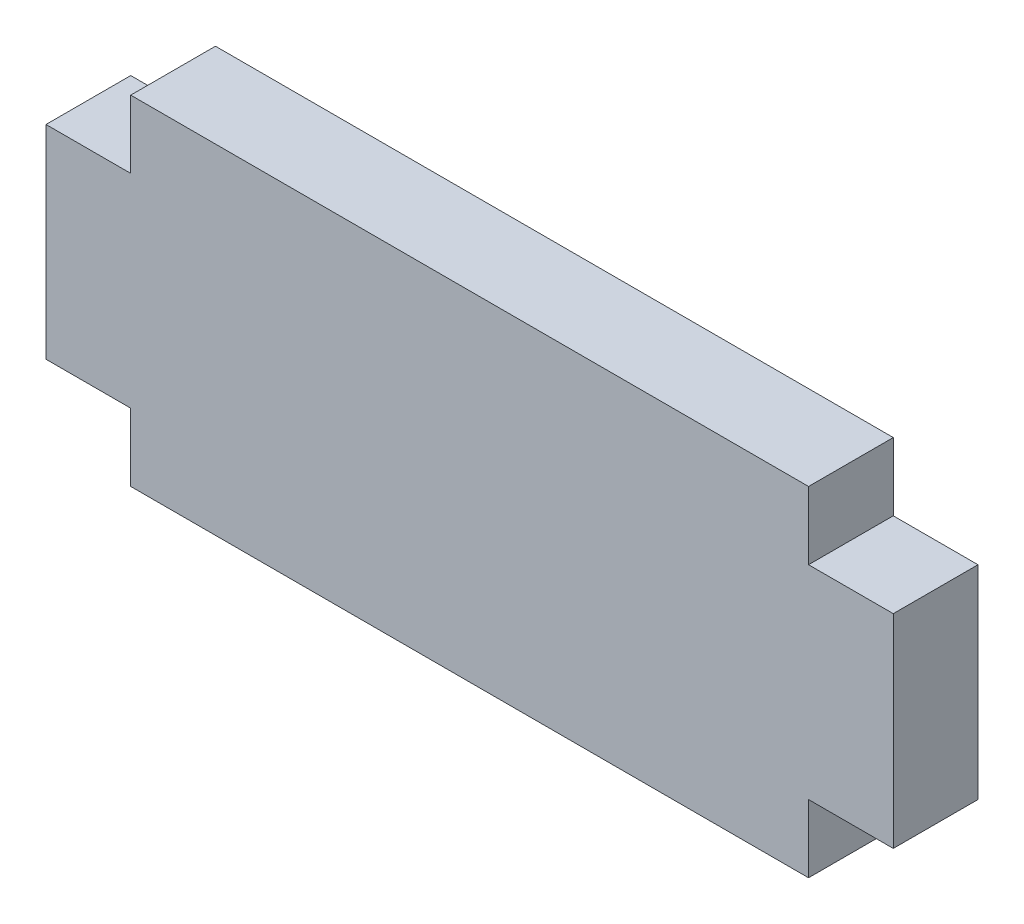
from build123d import *

# Parameters (mm, degrees)
SKETCH1_W           = 25.4
SKETCH1_H           = 12.7
BOSS_EXTRUDE1_DEPTH = 3.175
SKETCH2_W           = 3.175
SKETCH2_H           = 7.62
BOSS_EXTRUDE2_DEPTH = 3.175


with BuildPart() as part:
    # Sketch1 → Boss-Extrude1 (new body)
    with BuildSketch(Plane.XY):
        with Locations((12.7, 6.35)):
            Rectangle(SKETCH1_W, SKETCH1_H)
    extrude(amount=BOSS_EXTRUDE1_DEPTH)

    # Sketch2 → Boss-Extrude2 (add)
    with BuildSketch(Plane.XY.offset(3.175)):
        with Locations((-1.5875, 6.35)):
            Rectangle(SKETCH2_W, SKETCH2_H)
        with Locations((26.9875, 6.35)):
            Rectangle(SKETCH2_W, SKETCH2_H)
    extrude(amount=-BOSS_EXTRUDE2_DEPTH)


solid = part.part
